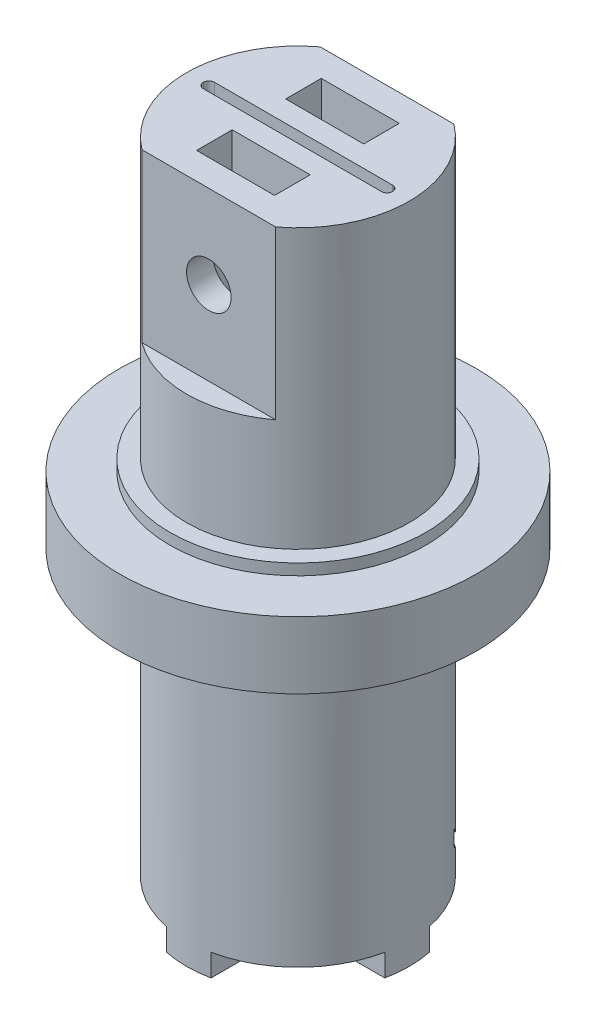
from build123d import *

# Parameters (mm, degrees)
SKETCH_2_W               = 17
SKETCH_2_H               = 1
CUT_EXTRUDE_1_DEPTH      = 26
FILLET_1_R               = 0.5
CUT_EXTRUDE_START        = -15
CUT_EXTRUDE_2_DEPTH      = 15
CUT_EXTRUDE_3_DEPTH      = 15
SKETCH_5_R               = 2
CUT_EXTRUDE_4_DEPTH      = 17
EXTRUDE_START            = 2
EXTRUDE_1_DEPTH          = 2
CUT_EXTRUDE_5_DEPTH      = 8
CUT_EXTRUDE_5_DEPTH_BACK = 8


with BuildPart() as part:
    # 草图1 → 旋转1 (revolve)
    with BuildSketch(Plane.XY, mode=Mode.PRIVATE) as revolve_1_sk:
        Polygon((5, 2.5), (5, 60), (-5, 60), (-5, 35), (-6.5, 35), (-6.5, 34), (-11, 34), (-11, 28), (-5, 28), (-5, 2.5), align=None)
    revolve(revolve_1_sk.sketch.rotate(Axis((5, 2.5, 0), (0, 1, 0)), 270), axis=Axis((5, 2.5, 0), (0, 1, 0)))

    # 草图2 → 切除-拉伸1 (cut)
    with BuildSketch(Plane(origin=(0, 60, 0), x_dir=(1, 0, 0), z_dir=(0, 1, 0))):
        with Locations((5, 0)):
            Rectangle(SKETCH_2_W, SKETCH_2_H)
    extrude(amount=-CUT_EXTRUDE_1_DEPTH, mode=Mode.SUBTRACT)

    # 圆角1
    fillet_1_edges = [part.edges().sort_by_distance(p)[0] for p in [
        (-3.5, 47, 0.5),
        (-3.5, 47, -0.5),
        (13.5, 47, 0.5),
        (13.5, 47, -0.5),
    ]]
    fillet(fillet_1_edges, radius=FILLET_1_R - 0.0001)  # a hair under: the kernel refuses the full size

    # 草图3 → 切除-拉伸2 (cut)
    with BuildSketch(Plane(origin=(0, 60, 0), x_dir=(1, 0, 0), z_dir=(0, 1, 0)).offset(CUT_EXTRUDE_START)):
        with BuildLine():
            Line((5, -8), (11, -8))
            ThreePointArc((11, -8), (5, -10), (-1, -8))
            Line((-1, -8), (5, -8))
        make_face()
        with BuildLine():
            Line((5, 8), (11, 8))
            ThreePointArc((11, 8), (5, 10), (-1, 8))
            Line((-1, 8), (5, 8))
        make_face()
    extrude(amount=CUT_EXTRUDE_2_DEPTH, mode=Mode.SUBTRACT)

    # 草图4 → 切除-拉伸3 (cut)
    with BuildSketch(Plane(origin=(0, 60, 0), x_dir=(1, 0, 0), z_dir=(0, 1, 0))):
        Polygon((1.5, -2.4), (1.5, -4), (1.5, -5.6), (8.5, -5.6), (8.5, -2.4), align=None)
        Polygon((1.5, 4), (1.5, 2.4), (8.5, 2.4), (8.5, 5.6), (1.5, 5.6), align=None)
    extrude(amount=-CUT_EXTRUDE_3_DEPTH, mode=Mode.SUBTRACT)

    # 草图5 → 切除-拉伸4 (cut)
    with BuildSketch(Plane(origin=(0, 0, -8), x_dir=(-1, 0, 0), z_dir=(0, 0, -1))):
        with Locations((-5, 52.5)):
            Circle(SKETCH_5_R)
    extrude(amount=-CUT_EXTRUDE_4_DEPTH, mode=Mode.SUBTRACT)

    # 草图6 → 凸台-拉伸1 (add)
    with BuildSketch(Plane.XZ.offset(-2.5).offset(EXTRUDE_START)):
        with BuildLine():
            Line((7, 2), (14.797958971, 2))
            ThreePointArc((14.797958971, 2), (15, 0), (14.797958971, -2))
            Line((14.797958971, -2), (7, -2))
            Line((7, -2), (7, -9.797958971))
            ThreePointArc((7, -9.797958971), (5, -10), (3, -9.797958971))
            Line((3, -9.797958971), (3, -2))
            Line((3, -2), (-4.797958971, -2))
            ThreePointArc((-4.797958971, -2), (-5, 0), (-4.797958971, 2))
            Line((-4.797958971, 2), (3, 2))
            Line((3, 2), (3, 9.797958971))
            ThreePointArc((3, 9.797958971), (5, 10), (7, 9.797958971))
            Line((7, 9.797958971), (7, 2))
        make_face()
    extrude(amount=-EXTRUDE_1_DEPTH)

    # 草图7 → 切除-拉伸5 (cut, two sides: drawn at the far end of the back side and taken through both)
    with BuildSketch(Plane(origin=(5, 0, 0), x_dir=(0, 0, -1), z_dir=(1, 0, 0)).offset(-CUT_EXTRUDE_5_DEPTH_BACK)):
        with BuildLine():
            Line((10, 4.510210526), (10, 3.510210526))
            add(Edge.make_bspline(
                [(-0.5, 34), (-0.5, 3.510210526), (10, 3.510210526)],
                knots=[1.570796327, 1.570796327, 1.570796327, 3.141592654, 3.141592654, 3.141592654], degree=2, weights=[1, 0.707106781, 1]))
            Line((-0.5, 34), (0.5, 34))
            add(Edge.make_bspline(
                [(0.5, 34), (0.5, 4.510210526), (10, 4.510210526)],
                knots=[1.570796327, 1.570796327, 1.570796327, 3.141592654, 3.141592654, 3.141592654], degree=2, weights=[1, 0.707106781, 1]))
        make_face()
    extrude(amount=CUT_EXTRUDE_5_DEPTH + CUT_EXTRUDE_5_DEPTH_BACK, mode=Mode.SUBTRACT)


solid = part.part
